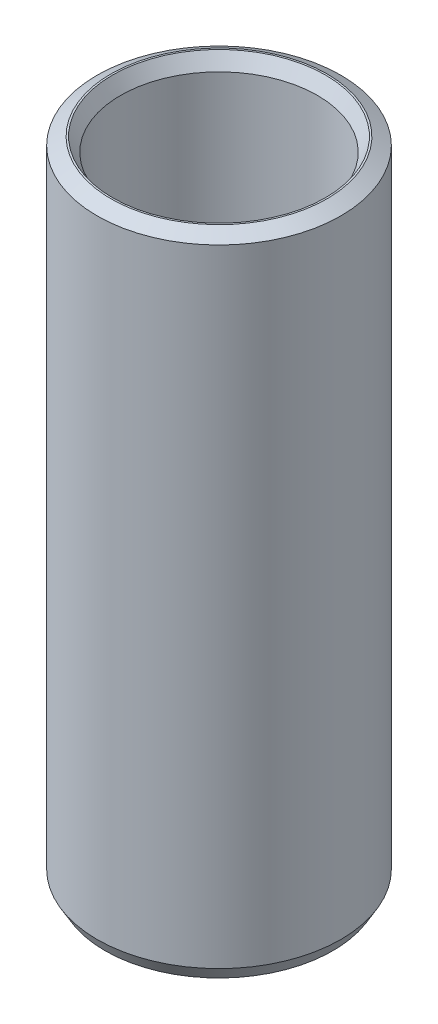
from build123d import *
from OCP.BRepFilletAPI import BRepFilletAPI_MakeChamfer

# Parameters (mm, degrees)
SKETCH1_R           = 37.5
BOSS_EXTRUDE1_DEPTH = 199.474999871
SKETCH2_R           = 30.294666393
CUT_EXTRUDE1_DEPTH  = 207.404398145
CHAMFER1_SIZE       = 2.441271606
CHAMFER1_SIZE2      = 4.228406456


with BuildPart() as part:
    # Sketch1 → Boss-Extrude1 (new body)
    with BuildSketch(Plane(origin=(0, 0, 0), x_dir=(1, 0, 0), z_dir=(0, 1, 0))):
        Circle(SKETCH1_R)
    extrude(amount=BOSS_EXTRUDE1_DEPTH)

    # Sketch2 → Cut-Extrude1 (cut, through all)
    with BuildSketch(Plane(origin=(0, 0, 0), x_dir=(1, 0, 0), z_dir=(0, 1, 0))):
        Circle(SKETCH2_R)
    extrude(amount=CUT_EXTRUDE1_DEPTH, mode=Mode.SUBTRACT)

    # Chamfer1: one chamfer whose edges measure the first distance from different faces: ONE call of the kernel's chamfer builder (chamfer() names one face for all edges)
    chamfer1_edges_1 = [part.edges().sort_by_distance(p)[0] for p in [
        (-30.294666393, 199.474999871, 0),
    ]]
    chamfer1_side_1 = [part.faces().sort_by_distance(p)[0] for p in [
        (-36.439339828, 199.474999871, 0),
    ]]
    chamfer1_edges_2 = [part.edges().sort_by_distance(p)[0] for p in [
        (-30.294666393, 0, 0),
    ]]
    chamfer1_side_2 = [part.faces().sort_by_distance(p)[0] for p in [
        (-30.294666393, 99.737499935, 0),
    ]]
    chamfer1_edges_3 = [part.edges().sort_by_distance(p)[0] for p in [
        (-37.5, 0, 0),
    ]]
    chamfer1_side_3 = [part.faces().sort_by_distance(p)[0] for p in [
        (-36.439339828, 0, 0),
    ]]
    chamfer1_edges_4 = [part.edges().sort_by_distance(p)[0] for p in [
        (-37.5, 199.474999871, 0),
    ]]
    chamfer1_side_4 = [part.faces().sort_by_distance(p)[0] for p in [
        (-37.5, 99.737499935, 0),
    ]]
    chamfer1 = BRepFilletAPI_MakeChamfer(part.part.solid().wrapped)
    for e in chamfer1_edges_1:
        chamfer1.Add(CHAMFER1_SIZE, CHAMFER1_SIZE2, e.wrapped, chamfer1_side_1[0].wrapped)  # the first distance lies on this face
    for e in chamfer1_edges_2:
        chamfer1.Add(CHAMFER1_SIZE, CHAMFER1_SIZE2, e.wrapped, chamfer1_side_2[0].wrapped)  # the first distance lies on this face
    for e in chamfer1_edges_3:
        chamfer1.Add(CHAMFER1_SIZE, CHAMFER1_SIZE2, e.wrapped, chamfer1_side_3[0].wrapped)  # the first distance lies on this face
    for e in chamfer1_edges_4:
        chamfer1.Add(CHAMFER1_SIZE, CHAMFER1_SIZE2, e.wrapped, chamfer1_side_4[0].wrapped)  # the first distance lies on this face
    add(Compound.cast(chamfer1.Shape()), mode=Mode.REPLACE)


solid = part.part
